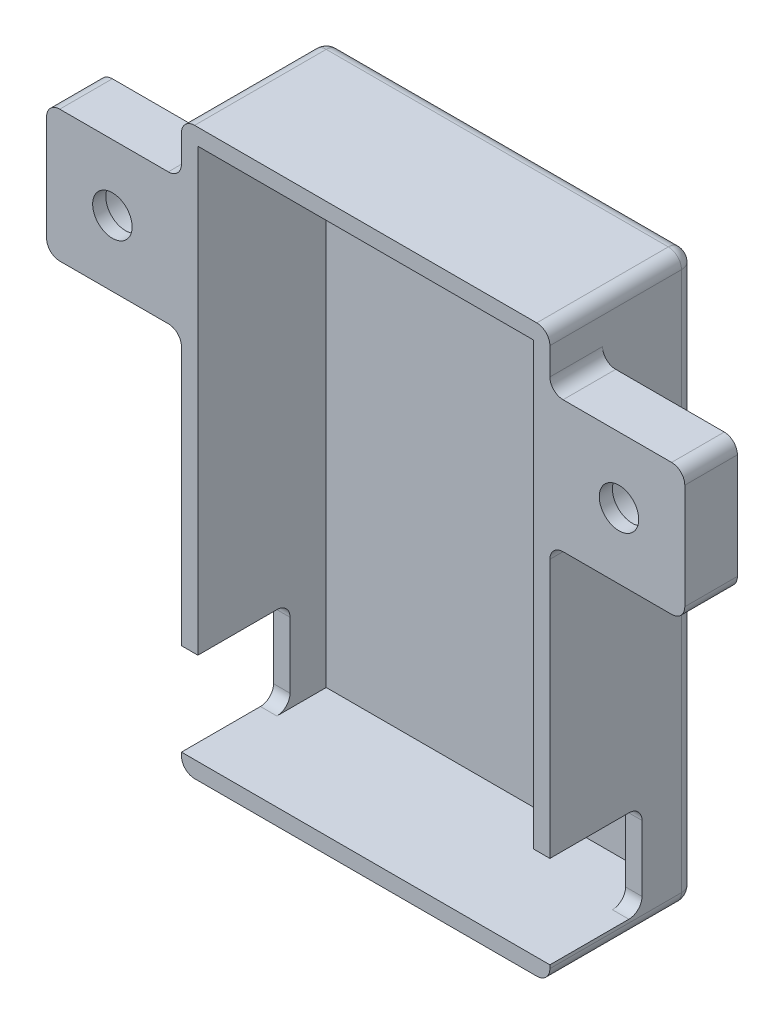
from build123d import *

# Parameters (mm, degrees)
SKETCH1_W             = 28
SKETCH1_H             = 43
BOSS_EXTRUDE1_DEPTH   = 1.25
SKETCH2_W             = 28
SKETCH2_H             = 43
SKETCH2_W_2           = 25.5
SKETCH2_H_2           = 40.5
BOSS_EXTRUDE2_DEPTH   = 2.75
SKETCH4_W             = 28
SKETCH4_H             = 1.25
BOSS_EXTRUDE3_DEPTH   = 7
SKETCH12_W            = 10.25
SKETCH12_H            = 10
SKETCH12_R            = 1.5
BOSS_EXTRUDE5_DEPTH   = 4
FILLET3_R             = 1
SKETCH13_R            = 2.25
CUT_EXTRUDE2_DEPTH    = 3
MIRROR1_START         = 7
MIRROR1_OUTLINE_R     = 2.25
MIRROR1_DEPTH         = 4
MIRROR1_START_2       = 10
MIRROR1_2_OUTLINE_R   = 2.25
MIRROR1_2_OUTLINE_R_2 = 1.5
MIRROR1_2_DEPTH       = 1
FILLET4_R             = 1
FILLET5_R             = 1
FILLET6_R             = 1
FILLET7_R             = 1


# Read off the part's stored shape, not the designer's step: Mirror1
with BuildPart() as part:
    # Sketch1 → Boss-Extrude1 (new body)
    with BuildSketch(Plane.XY):
        Rectangle(SKETCH1_W, SKETCH1_H)
    extrude(amount=BOSS_EXTRUDE1_DEPTH)

    # Sketch2 → Boss-Extrude2 (add)
    with BuildSketch(Plane.XY.offset(1.25)):
        Rectangle(SKETCH2_W, SKETCH2_H)
        Rectangle(SKETCH2_W_2, SKETCH2_H_2, mode=Mode.SUBTRACT)
    extrude(amount=BOSS_EXTRUDE2_DEPTH)

    # Sketch4 → Boss-Extrude3 (add)
    with BuildSketch(Plane.XY.offset(4)):
        with Locations((0, -20.875)):
            Rectangle(SKETCH4_W, SKETCH4_H)
        Polygon((12.75, -13.25), (12.75, 20.25), (-12.75, 20.25), (-12.75, -13.25), (-14, -13.25), (-14, 21.5), (14, 21.5), (14, -13.25), align=None)
    extrude(amount=BOSS_EXTRUDE3_DEPTH)

    # Sketch12 → Boss-Extrude5 (add)
    with BuildSketch(Plane.XY.offset(11)):
        with Locations((19.125, 12.44)):
            Rectangle(SKETCH12_W, SKETCH12_H)
        with Locations((19.25, 12.44)):
            Circle(SKETCH12_R, mode=Mode.SUBTRACT)
    extrude(amount=-BOSS_EXTRUDE5_DEPTH)

    # Fillet3
    fillet3_edges = [part.edges().sort_by_distance(p)[0] for p in [
        (14, 7.44, 9),
        (14, 17.44, 9),
        (24.25, 17.44, 9),
        (24.25, 7.44, 9),
    ]]
    fillet(fillet3_edges, radius=FILLET3_R)

    # Sketch13 → Cut-Extrude2 (cut)
    with BuildSketch(Plane(origin=(0, 0, 7), x_dir=(-1, 0, 0), z_dir=(0, 0, -1))):
        with Locations((-19.25, 12.44)):
            Circle(SKETCH13_R)
    extrude(amount=-CUT_EXTRUDE2_DEPTH, mode=Mode.SUBTRACT)

    # Mirror1 outline → Mirror1 (add)
    with BuildSketch(Plane.XY.offset(MIRROR1_START)):
        with BuildLine():
            Line((-14, 17.44), (-23.25, 17.44))
            ThreePointArc((-23.25, 17.44), (-23.957106781, 17.147106781), (-24.25, 16.44))
            Line((-24.25, 16.44), (-24.25, 8.44))
            ThreePointArc((-24.25, 8.44), (-23.957106781, 7.732893219), (-23.25, 7.44))
            Line((-23.25, 7.44), (-14, 7.44))
            Line((-14, 7.44), (-14, 17.44))
        make_face()
        with Locations((-19.25, 12.44)):
            Circle(MIRROR1_OUTLINE_R, mode=Mode.SUBTRACT)
    extrude(amount=MIRROR1_DEPTH)

    # Mirror1 2 outline → Mirror1 2 (add)
    with BuildSketch(Plane.XY.offset(MIRROR1_START_2)):
        with Locations((-19.25, 12.44)):
            Circle(MIRROR1_2_OUTLINE_R)
        with Locations((-19.25, 12.44)):
            Circle(MIRROR1_2_OUTLINE_R_2, mode=Mode.SUBTRACT)
    extrude(amount=MIRROR1_2_DEPTH)

    # Fillet4
    fillet4_edges = [part.edges().sort_by_distance(p)[0] for p in [
        (-13.375, -20.25, 4),
        (13.375, -13.25, 4),
        (-13.375, -13.25, 4),
        (13.375, -20.25, 4),
    ]]
    fillet(fillet4_edges, radius=FILLET4_R)

    # Fillet5
    fillet5_edges = [part.edges().sort_by_distance(p)[0] for p in [
        (0, 21.5, 0),
        (14, 0, 0),
        (0, -21.5, 0),
        (-14, 0, 0),
    ]]
    fillet(fillet5_edges, radius=FILLET5_R)

    # Fillet6
    # the kernel refuses this fillet: 1 mm, written as the material it takes off along each edge
    with BuildSketch(Plane(origin=(13, -20.5, 1), x_dir=(0, -1, 0), z_dir=(1, 0, 0))) as fillet6_piece_1_section:
        Polygon((0, 0), (FILLET6_R, 0), (FILLET6_R, FILLET6_R), (0, FILLET6_R), align=None)
    fillet6_piece_1 = extrude(amount=FILLET6_R, mode=Mode.PRIVATE)
    fillet6_piece_1 = fillet6_piece_1 - Plane(origin=(13, -20.5, 1), x_dir=(0, 0.7071067811865475, 0.7071067811865475), z_dir=(1, 0, 0)) * Sphere(FILLET6_R, mode=Mode.PRIVATE)
    add(fillet6_piece_1, mode=Mode.SUBTRACT)
    with BuildSketch(Plane(origin=(-13, -20.5, 1), x_dir=(-1, 0, 0), z_dir=(0, -1, 0))) as fillet6_piece_2_section:
        Polygon((0, 0), (FILLET6_R, 0), (FILLET6_R, FILLET6_R), (0, FILLET6_R), align=None)
    fillet6_piece_2 = extrude(amount=FILLET6_R, mode=Mode.PRIVATE)
    fillet6_piece_2 = fillet6_piece_2 - Plane(origin=(-13, -20.5, 1), x_dir=(0.7071067811865475, 0, 0.7071067811865475), z_dir=(0, -1, 0)) * Sphere(FILLET6_R, mode=Mode.PRIVATE)
    add(fillet6_piece_2, mode=Mode.SUBTRACT)
    with BuildSketch(Plane(origin=(13, 20.5, 1), x_dir=(0, 1, 0), z_dir=(1, 0, 0))) as fillet6_piece_3_section:
        Polygon((0, 0), (FILLET6_R, 0), (FILLET6_R, -FILLET6_R), (0, -FILLET6_R), align=None)
    fillet6_piece_3 = extrude(amount=FILLET6_R, mode=Mode.PRIVATE)
    fillet6_piece_3 = fillet6_piece_3 - Plane(origin=(13, 20.5, 1), x_dir=(0, -0.7071067811865475, 0.7071067811865475), z_dir=(1, 0, 0)) * Sphere(FILLET6_R, mode=Mode.PRIVATE)
    add(fillet6_piece_3, mode=Mode.SUBTRACT)
    with BuildSketch(Plane(origin=(-13, 20.5, 1), x_dir=(-1, 0, 0), z_dir=(0, 1, 0))) as fillet6_piece_4_section:
        Polygon((0, 0), (FILLET6_R, 0), (FILLET6_R, -FILLET6_R), (0, -FILLET6_R), align=None)
    fillet6_piece_4 = extrude(amount=FILLET6_R, mode=Mode.PRIVATE)
    fillet6_piece_4 = fillet6_piece_4 - Plane(origin=(-13, 20.5, 1), x_dir=(0.7071067811865475, 0, 0.7071067811865475), z_dir=(0, 1, 0)) * Sphere(FILLET6_R, mode=Mode.PRIVATE)
    add(fillet6_piece_4, mode=Mode.SUBTRACT)
    with BuildSketch(Plane(origin=(-14, 21.5, 1), x_dir=(1, 0, 0), z_dir=(0, 0, 1)), Plane(origin=(14, -21.5, 13.5), x_dir=(0, 1, 0), z_dir=(0, 0, -1))) as fillet6_piece_5:
        with BuildLine():
            CenterArc((FILLET6_R, -FILLET6_R), FILLET6_R, 90, 90)
            Line((0, -FILLET6_R), (0, 0))
            Line((0, 0), (FILLET6_R, 0))
        make_face()
    extrude(amount=12.5, mode=Mode.SUBTRACT)
    with BuildSketch(Plane(origin=(14, 21.5, 13.5), x_dir=(0, -1, 0), z_dir=(0, 0, -1)), Plane(origin=(-14, -21.5, 1), x_dir=(1, 0, 0), z_dir=(0, 0, 1))) as fillet6_piece_6:
        with BuildLine():
            CenterArc((FILLET6_R, FILLET6_R), FILLET6_R, 180, 90)
            Line((0, FILLET6_R), (0, 0))
            Line((0, 0), (FILLET6_R, 0))
        make_face()
    extrude(amount=12.5, mode=Mode.SUBTRACT)

    # Fillet7
    fillet7_edges = [part.edges().sort_by_distance(p)[0] for p in [
        (-14, 17.44, 9),
        (-14, 7.44, 9),
    ]]
    fillet(fillet7_edges, radius=FILLET7_R)


solid = part.part
